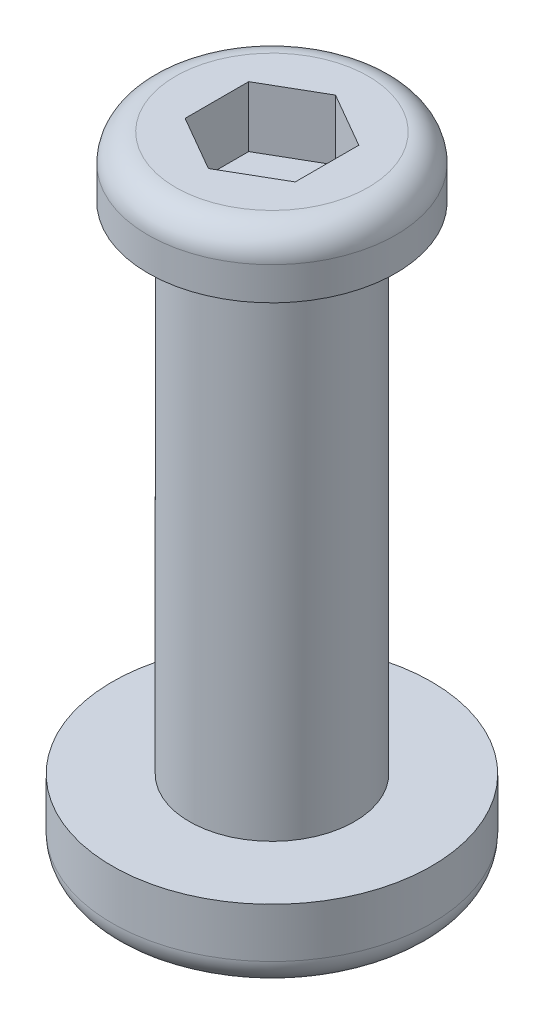
from build123d import *

# Parameters (mm, degrees)
SKETCH_1_R      = 1.5
EXTRUDE_1_DEPTH = 9
SKETCH_2_R      = 2.25
EXTRUDE_2_DEPTH = 1.1
SKETCH_3_R      = 2.9
EXTRUDE_3_DEPTH = 1.4
FILLET_1_R      = 0.5


with BuildPart() as part:
    # 草图1 → 凸台-拉伸1 (new body)
    with BuildSketch(Plane(origin=(0, 0, 0), x_dir=(1, 0, 0), z_dir=(0, 1, 0))):
        Circle(SKETCH_1_R)
    extrude(amount=EXTRUDE_1_DEPTH)

    # 草图2 → 凸台-拉伸2 (add)
    with BuildSketch(Plane(origin=(0, 9, 0), x_dir=(1, 0, 0), z_dir=(0, 1, 0))):
        Circle(SKETCH_2_R)
        Polygon((0, 1.154700538), (-1, 0.577350269), (-1, -0.577350269), (0, -1.154700538), (1, -0.577350269), (1, 0.577350269), align=None, mode=Mode.SUBTRACT)
    extrude(amount=EXTRUDE_2_DEPTH)

    # 草图3 → 凸台-拉伸3 (add)
    with BuildSketch(Plane.XZ):
        Circle(SKETCH_3_R)
        Polygon((0, 1.154700538), (-1, 0.577350269), (-1, -0.577350269), (0, -1.154700538), (1, -0.577350269), (1, 0.577350269), align=None, mode=Mode.SUBTRACT)
    extrude(amount=EXTRUDE_3_DEPTH)

    # 圆角1
    fillet_1_edges = [part.edges().sort_by_distance(p)[0] for p in [
        (-2.25, 10.1, 0),
        (-2.9, -1.4, 0),
    ]]
    fillet(fillet_1_edges, radius=FILLET_1_R)


solid = part.part
